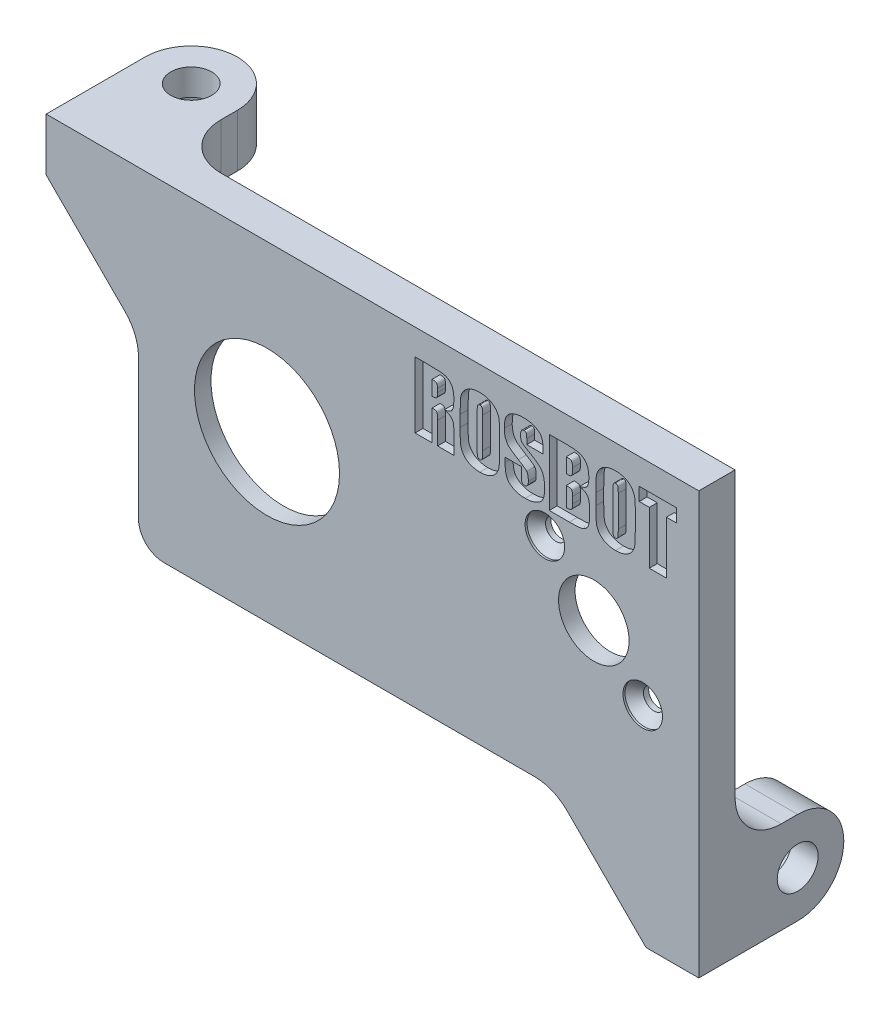
from build123d import *

# Parameters (mm, degrees)
SKETCH1_R                                      = 11
SKETCH1_R_2                                    = 5.35
SKETCH1_R_3                                    = 1.6
BOSS_EXTRUDE1_DEPTH                            = 2.5
BOSS_EXTRUDE2_DEPTH                            = 3
SKETCH3_W                                      = 8
SKETCH3_H                                      = 14
SKETCH3_W_2                                    = 14
SKETCH3_H_2                                    = 8
BOSS_EXTRUDE3_DEPTH                            = 16.5
SKETCH5_R                                      = 5
CUT_EXTRUDE2_DEPTH                             = 4
CUT_EXTRUDE3_REACH                             = 117.294
SKETCH6_R                                      = 3.1
SKETCH7_R                                      = 5
CUT_EXTRUDE4_DEPTH                             = 4
CUT_EXTRUDE5_REACH                             = 106.316
SKETCH8_R                                      = 3.1
CSK_FOR_M3_FLAT_HEAD_MACHINE_SCREW1_AT_2_COUNT = 2
CSK_FOR_M3_FLAT_HEAD_MACHINE_SCREW1_AT_2_PITCH = 21
FILLET1_R                                      = 7
SKETCH11_R                                     = 17.5
CUT_EXTRUDE6_DEPTH                             = 3
CUT_EXTRUDE7_DEPTH                             = 1.2
FILLET2_R                                      = 3.85


with BuildPart() as part:
    # Sketch1 → Boss-Extrude1 (new body)
    with BuildSketch(Plane.XY):
        Polygon((-83.075378798, 25), (-83.075378798, 17), (-69.075378798, 3), (-69.075378798, -25), (-6.075378798, -25), (7.924621202, -39), (15.924621202, -39), (15.924621202, 25), align=None)
        with Locations((-49.575378798, 0)):
            Circle(SKETCH1_R, mode=Mode.SUBTRACT)
        Circle(SKETCH1_R_2, mode=Mode.SUBTRACT)
        with Locations((-7.424621202, 7.424621202)):
            Circle(SKETCH1_R_3, mode=Mode.SUBTRACT)
        with Locations((7.424621202, -7.424621202)):
            Circle(SKETCH1_R_3, mode=Mode.SUBTRACT)
    extrude(amount=BOSS_EXTRUDE1_DEPTH)

    # Sketch2 → Boss-Extrude2 (add)
    with BuildSketch(Plane(origin=(0, 0, 0), x_dir=(-1, 0, 0), z_dir=(0, 0, -1))):
        Polygon((-15.924621202, 25), (-15.924621202, -39), (-7.924621202, -39), (6.075378798, -25), (69.075378798, -25), (69.075378798, 3), (83.075378798, 17), (83.075378798, 25), align=None)
        Polygon((4.83273811, -22), (1.83273811, -25), (-12.924621202, -25), (-12.924621202, 22), (69.075378798, 22), (69.075378798, 7.242640687), (66.075378798, 4.242640687), (66.075378798, -22), align=None, mode=Mode.SUBTRACT)
    extrude(amount=BOSS_EXTRUDE2_DEPTH)

    # Sketch3 → Boss-Extrude3 (add)
    with BuildSketch(Plane(origin=(0, 0, -3), x_dir=(-1, 0, 0), z_dir=(0, 0, -1))):
        with Locations((-11.924621202, -32)):
            Rectangle(SKETCH3_W, SKETCH3_H)
        with Locations((76.075378798, 21)):
            Rectangle(SKETCH3_W_2, SKETCH3_H_2)
    extrude(amount=BOSS_EXTRUDE3_DEPTH)

    # Sketch5 → Cut-Extrude2 (cut)
    with BuildSketch(Plane(origin=(7.924621202, -48.924621202, 0), x_dir=(0, 1, 0), z_dir=(1, 0, 0))):
        with Locations(Location((16.924621202, -12.5, 0), (0, 0, 270))):
            Circle(SKETCH5_R)
    extrude(amount=CUT_EXTRUDE2_DEPTH, mode=Mode.SUBTRACT)

    # Sketch6 → Cut-Extrude3 (cut, up to next)
    with BuildSketch(Plane(origin=(11.924621202, 23.349242405, 0), x_dir=(0, -1, 0), z_dir=(-1, 0, 0)), mode=Mode.PRIVATE) as cut_extrude3_sk1:
        with Locations(Location((55.349242405, -12.5, 0), (0, 0, 90))):
            Circle(SKETCH6_R)
    cut_extrude3_tool1 = extrude(cut_extrude3_sk1.sketch, amount=-CUT_EXTRUDE3_REACH, mode=Mode.PRIVATE) & part.part
    add(cut_extrude3_tool1.solids().sort_by_distance((11.924621, -32, -12.5))[0], mode=Mode.SUBTRACT)

    # Sketch7 → Cut-Extrude4 (cut)
    with BuildSketch(Plane(origin=(26.424621202, 17, 0), x_dir=(0, 0, 1), z_dir=(0, -1, 0))):
        with Locations(Location((-12.5, 102.5, 0), (0, 0, 180))):
            Circle(SKETCH7_R)
    extrude(amount=-CUT_EXTRUDE4_DEPTH, mode=Mode.SUBTRACT)

    # Sketch8 → Cut-Extrude5 (cut, up to next)
    with BuildSketch(Plane(origin=(0, 21, 0), x_dir=(0, 0, 1), z_dir=(0, -1, 0)), mode=Mode.PRIVATE) as cut_extrude5_sk1:
        with Locations(Location((-12.5, 76.075378798, 0), (0, 0, 270))):
            Circle(SKETCH8_R)
    cut_extrude5_tool1 = extrude(cut_extrude5_sk1.sketch, amount=-CUT_EXTRUDE5_REACH, mode=Mode.PRIVATE) & part.part
    add(cut_extrude5_tool1.solids().sort_by_distance((-76.075379, 21, -12.5))[0], mode=Mode.SUBTRACT)

    # Sketch10 → CSK for M3 Flat Head Machine Screw1 (revolve, cut)
    with BuildSketch(Plane(origin=(-7.424621202, 7.424621202, 2.5), x_dir=(0, -1, 0), z_dir=(1, 0, 0))):
        Polygon((0, 0), (0, 3.400290929), (1.5, 2.499), (1.5, 1.8), (3, 0.3), (3, 0), align=None)
    csk_for_m3_flat_head_machine_screw1 = revolve(axis=Axis((-7.424621202, 7.424621202, 8.85), (0, 0, -1)), mode=Mode.SUBTRACT)

    # CSK for M3 Flat Head Machine Screw1 at 2: CSK for M3 Flat Head Machine Screw1 ×2
    with Locations(*[Vector(0.707106781186549, -0.707106781186546, 0) * (i * CSK_FOR_M3_FLAT_HEAD_MACHINE_SCREW1_AT_2_PITCH) for i in range(1, CSK_FOR_M3_FLAT_HEAD_MACHINE_SCREW1_AT_2_COUNT)]):
        add(csk_for_m3_flat_head_machine_screw1, mode=Mode.SUBTRACT)

    # Fillet1
    # the kernel refuses this fillet: 7 mm, written as the material it adds along each edge
    with BuildSketch(Plane(origin=(-69.075378798, 3, -3), x_dir=(-0.7071067811865492, 0.7071067811865459, 0), z_dir=(0, 0, 1))) as fillet1_piece_1:
        with BuildLine():
            CenterArc((FILLET1_R * 0.414213562373, FILLET1_R), FILLET1_R, 225, 45)
            Line((-FILLET1_R * 0.292893218813, FILLET1_R * 0.292893218813), (0, 0))
            Line((0, 0), (FILLET1_R * 0.414213562373, 0))
        make_face()
    extrude(amount=5.5)
    with BuildSketch(Plane(origin=(-6.075378798, -25, -3), x_dir=(0.7071067811865499, -0.7071067811865452, 0), z_dir=(0, 0, 1))) as fillet1_piece_2:
        with BuildLine():
            CenterArc((FILLET1_R * 0.414213562373, -FILLET1_R), FILLET1_R, 90, 45)
            Line((-FILLET1_R * 0.292893218813, -FILLET1_R * 0.292893218813), (0, 0))
            Line((0, 0), (FILLET1_R * 0.414213562373, 0))
        make_face()
    extrude(amount=5.5)
    with BuildSketch(Plane(origin=(15.924621202, -25, -3), x_dir=(0, 1, 0), z_dir=(-1, 0, 0)), Plane(origin=(-69.075378798, 22, -3), x_dir=(1, 0, 0), z_dir=(0, 1, 0))) as fillet1_piece_3:
        with BuildLine():
            CenterArc((FILLET1_R, FILLET1_R), FILLET1_R, 180, 90)
            Line((0, FILLET1_R), (0, 0))
            Line((0, 0), (FILLET1_R, 0))
        make_face()
    extrude(amount=3)
    with BuildSketch(Plane(origin=(7.924621202, -25, -3), x_dir=(-1, 0, 0), z_dir=(0, -1, 0))) as fillet1_piece_4_section:
        with BuildLine():
            CenterArc((FILLET1_R, FILLET1_R), FILLET1_R, 180, 90)
            Line((0, FILLET1_R), (0, 0))
            Line((0, 0), (FILLET1_R, 0))
        make_face()
    fillet1_piece_4 = extrude(amount=31.5, mode=Mode.PRIVATE)
    fillet1_piece_4 = split(fillet1_piece_4, bisect_by=Plane(origin=(3.342862326, -34.418241124, -4.598046735), z_dir=(0.7071067811865462, 0.7071067811865488, 0)), keep=Keep.TOP, mode=Mode.PRIVATE)
    fillet1_piece_4 = fillet1_piece_4 - Plane(origin=(6.482756433, -32, -12.5), x_dir=(0, 0, -1), z_dir=(-1, 0, 0)) * Cylinder(5, 91, mode=Mode.PRIVATE)
    add(fillet1_piece_4)
    with BuildSketch(Plane(origin=(-100.575378798, 17, -3), x_dir=(0, 0, -1), z_dir=(1, 0, 0))) as fillet1_piece_5_section:
        with BuildLine():
            CenterArc((FILLET1_R, -FILLET1_R), FILLET1_R, 90, 90)
            Line((0, -FILLET1_R), (0, 0))
            Line((0, 0), (FILLET1_R, 0))
        make_face()
    fillet1_piece_5 = extrude(amount=31.5, mode=Mode.PRIVATE)
    fillet1_piece_5 = split(fillet1_piece_5, bisect_by=Plane(origin=(-78.493619852, 12.418241055, -4.598046745), z_dir=(0.7071067811865461, 0.7071067811865489, 0)), keep=Keep.TOP, mode=Mode.PRIVATE)
    fillet1_piece_5 = fillet1_piece_5 - Plane(origin=(-76.075378798, 15.558135209, -12.5), x_dir=(0, 0, -1), z_dir=(0, -1, 0)) * Cylinder(5, 91, mode=Mode.PRIVATE)
    add(fillet1_piece_5)
    # the kernel refuses this fillet: 7 mm, written as the material it takes off along each edge
    with BuildSketch(Plane(origin=(-69.075378798, -0.5, -19.5), x_dir=(0, 0, 1), z_dir=(0, 1, 0)), Plane(origin=(-9.575378798, -39, -19.5), x_dir=(0, 0, 1), z_dir=(1, 0, 0))) as fillet1_2_piece_1:
        with BuildLine():
            CenterArc((FILLET1_R, -FILLET1_R), FILLET1_R, 90, 90)
            Line((0, -FILLET1_R), (0, 0))
            Line((0, 0), (FILLET1_R, 0))
        make_face()
    extrude(amount=43, mode=Mode.SUBTRACT)
    with BuildSketch(Plane(origin=(-83.075378798, 42.5, -19.5), x_dir=(1, 0, 0), z_dir=(0, -1, 0)), Plane(origin=(33.424621202, -25, -19.5), x_dir=(0, -1, 0), z_dir=(-1, 0, 0))) as fillet1_2_piece_2:
        with BuildLine():
            CenterArc((FILLET1_R, FILLET1_R), FILLET1_R, 180, 90)
            Line((0, FILLET1_R), (0, 0))
            Line((0, 0), (FILLET1_R, 0))
        make_face()
    extrude(amount=43, mode=Mode.SUBTRACT)

    # Sketch11 → Cut-Extrude6 (cut)
    with BuildSketch(Plane(origin=(0, 0, -3), x_dir=(-1, 0, 0), z_dir=(0, 0, -1))):
        with Locations((49.575378798, 0)):
            Circle(SKETCH11_R)
    extrude(amount=-CUT_EXTRUDE6_DEPTH, mode=Mode.SUBTRACT)

    # Sketch12 → Cut-Extrude7 (cut)
    # profile 1 of 6: a face of its own
    with BuildSketch(Plane.XY.offset(2.5)):
        with BuildLine():
            Line((-27.11123462, 21.082253521), (-25.247264032, 21.082253521))
            add(Edge.make_bspline(
                [(-25.247264032, 21.082253521), (-25.097750298, 21.082111259), (-24.811569983, 21.081838959), (-24.401620237, 21.074040184), (-24.029659471, 21.063154062), (-23.69496531, 21.049424947), (-23.397738715, 21.029137103), (-23.138418633, 21.005704379), (-22.91681935, 20.979160328), (-22.727442801, 20.946215658), (-22.560530311, 20.903355334), (-22.406480095, 20.847058545), (-22.25907739, 20.780062571), (-22.120038951, 20.696352744), (-21.990341803, 20.598074853), (-21.865350225, 20.490054656), (-21.751593284, 20.364552372), (-21.642136629, 20.227474087), (-21.543193377, 20.071095988), (-21.459518473, 19.893564901), (-21.387698841, 19.695397363), (-21.329441209, 19.475713158), (-21.284320405, 19.23481106), (-21.250971544, 18.972765986), (-21.233796881, 18.689100512), (-21.230559569, 18.492812553), (-21.228881679, 18.391077051)],
                knots=[0, 0, 0, 0, 1.866779899, 3.573154429, 5.119271976, 6.513038993, 7.755301935, 8.838622109, 9.763847579, 10.541210176, 11.237085048, 11.91229758, 12.586642675, 13.255803272, 13.93365463, 14.616667368, 15.3150611, 16.045129356, 16.805014908, 17.619443337, 18.490747182, 19.433519973, 20.453845581, 21.548934602, 22.729619622, 24, 24, 24, 24], degree=3))
            add(Edge.make_bspline(
                [(-21.228881679, 18.391077051), (-21.229110661, 18.299131595), (-21.229549117, 18.123073714), (-21.245932121, 17.87058178), (-21.265376213, 17.641339421), (-21.299701229, 17.436040342), (-21.338638478, 17.253787019), (-21.387610614, 17.093764074), (-21.44750337, 16.95796896), (-21.517067507, 16.842690758), (-21.601366492, 16.745715996), (-21.701504087, 16.660465848), (-21.820770478, 16.587650798), (-21.956257213, 16.522979555), (-22.108950241, 16.468123213), (-22.279625694, 16.424887006), (-22.467397118, 16.389257017), (-22.599449732, 16.375948841), (-22.668219914, 16.369018227)],
                knots=[0, 0, 0, 0, 1.535739318, 2.940645737, 4.22619795, 5.377388088, 6.415609046, 7.338391501, 8.167869762, 8.889512328, 9.579072284, 10.305275152, 11.07790705, 11.906690103, 12.810190808, 13.783547141, 14.845718681, 16, 16, 16, 16], degree=3))
            add(Edge.make_bspline(
                [(-22.668219914, 16.369018227), (-22.606240467, 16.352193911), (-22.48665329, 16.319731982), (-22.315397299, 16.267475885), (-22.160360732, 16.209086567), (-22.022958484, 16.144219462), (-21.899634482, 16.078507095), (-21.79310567, 16.00707336), (-21.701682754, 15.931441388), (-21.604240186, 15.827803836), (-21.506338769, 15.697320561), (-21.408740848, 15.544890151), (-21.338195168, 15.39742496), (-21.296779086, 15.272304978), (-21.278528984, 15.159102399), (-21.263078818, 15.046500016), (-21.25374685, 14.903404666), (-21.244351978, 14.730619736), (-21.237504027, 14.528365165), (-21.23141574, 14.296750095), (-21.230918866, 14.03506823), (-21.229585836, 13.850634369), (-21.228881679, 13.753209403)],
                knots=[0, 0, 0, 0, 1.142598363, 2.204603636, 3.184543099, 4.08681795, 4.906404162, 5.66835307, 6.364867417, 7.012577891, 8.194392783, 9.262145755, 10.227668168, 11.096526183, 11.594793942, 12.265491166, 13.118334537, 14.144541448, 15.344519214, 16.718520618, 18.266598052, 20, 20, 20, 20], degree=3))
            Line((-21.228881679, 13.753209403), (-21.228881679, 11.082253521))
            Line((-21.228881679, 11.082253521), (-23.699469914, 11.082253521))
            Line((-23.699469914, 11.082253521), (-23.699469914, 14.464606462))
            add(Edge.make_bspline(
                [(-23.699469914, 14.464606462), (-23.699848894, 14.529557517), (-23.700567679, 14.652745848), (-23.705166937, 14.827532532), (-23.716759059, 14.983186026), (-23.730414739, 15.119465597), (-23.749028128, 15.236613968), (-23.769419615, 15.33438702), (-23.797041332, 15.412730529), (-23.828636584, 15.474973643), (-23.869800974, 15.525229323), (-23.925800514, 15.5627502), (-23.991679946, 15.598358717), (-24.072452331, 15.625579483), (-24.166379811, 15.644672046), (-24.27325056, 15.659169669), (-24.393557733, 15.66827582), (-24.478251753, 15.669723789), (-24.522999326, 15.670488815)],
                knots=[0, 0, 0, 0, 1.760695112, 3.339392938, 4.738153348, 5.990939473, 7.050443991, 7.953034352, 8.693792368, 9.295646617, 9.837944077, 10.432650982, 11.108765438, 11.865186032, 12.731754792, 13.704231872, 14.787044802, 16, 16, 16, 16], degree=3))
            Line((-24.522999326, 15.670488815), (-24.522999326, 11.082253521))
            Line((-24.522999326, 11.082253521), (-27.11123462, 11.082253521))
            Line((-27.11123462, 11.082253521), (-27.11123462, 21.082253521))
        make_face()
        with BuildLine():
            Line((-24.522999326, 19.435194698), (-24.522999326, 17.19990058))
            add(Edge.make_bspline(
                [(-24.522999326, 17.19990058), (-24.452459937, 17.20085114), (-24.321926424, 17.202610157), (-24.143664506, 17.226199134), (-23.999022009, 17.261460736), (-23.897891413, 17.305078173), (-23.837028253, 17.360807271), (-23.797898852, 17.417377685), (-23.768270543, 17.492453017), (-23.74274286, 17.58302544), (-23.723292679, 17.690149597), (-23.708348596, 17.813487322), (-23.702378234, 17.954137857), (-23.7004781, 18.053454471), (-23.699469914, 18.10615058)],
                knots=[0, 0, 0, 0, 1.706714887, 3.158284942, 4.338247242, 5.313333341, 5.775274278, 6.318418262, 6.963057242, 7.71890888, 8.594501264, 9.595306132, 10.724100569, 12, 12, 12, 12], degree=3))
            Line((-23.699469914, 18.10615058), (-23.699469914, 18.659459403))
            add(Edge.make_bspline(
                [(-23.699469914, 18.659459403), (-23.701117075, 18.732527369), (-23.704114478, 18.865492037), (-23.73579991, 19.045367046), (-23.788655081, 19.186737143), (-23.870884506, 19.293265984), (-23.989292659, 19.358381309), (-24.134882282, 19.405541494), (-24.317527311, 19.430840332), (-24.450635434, 19.433661161), (-24.522999326, 19.435194698)],
                knots=[0, 0, 0, 0, 1.304469539, 2.37379483, 3.247992823, 3.979792534, 4.721435155, 5.621572954, 6.706974207, 8, 8, 8, 8], degree=3))
        make_face(mode=Mode.SUBTRACT)
    # profile 2 of 6: a face of its own
    with BuildSketch(Plane.XY.offset(2.5)):
        with BuildLine():
            add(Edge.make_bspline(
                [(-14.287705208, 15.221959403), (-14.288379196, 15.10063608), (-14.289676114, 14.867180351), (-14.290566291, 14.530152575), (-14.295592945, 14.220665271), (-14.306112187, 13.938874512), (-14.313692835, 13.68506737), (-14.327142007, 13.45837255), (-14.341465287, 13.259167642), (-14.362237403, 13.031429794), (-14.405139786, 12.769796374), (-14.498450863, 12.472497914), (-14.63072726, 12.189664753), (-14.796755185, 11.921576923), (-14.999522503, 11.67595832), (-15.237373354, 11.459179612), (-15.508049438, 11.2723056), (-15.81115997, 11.117973131), (-16.143073778, 10.997911527), (-16.501261221, 10.908345354), (-16.88615101, 10.857981429), (-17.151533918, 10.850697089), (-17.287705208, 10.846959403)],
                knots=[0, 0, 0, 0, 1.172498254, 2.25617324, 3.257086853, 4.16358034, 4.981301874, 5.71084127, 6.358035375, 6.911319994, 7.920867218, 8.913513763, 9.91232314, 10.931067744, 11.953111379, 12.980015395, 14.031284524, 15.122408645, 16.257695467, 17.435386016, 18.684064487, 20, 20, 20, 20], degree=3))
            add(Edge.make_bspline(
                [(-17.287705208, 10.846959403), (-17.417782836, 10.849956598), (-17.672792092, 10.855832415), (-18.044382815, 10.907098516), (-18.396791393, 10.986447745), (-18.726047755, 11.102566772), (-19.030987988, 11.249589593), (-19.303612625, 11.435184576), (-19.549992512, 11.648111438), (-19.757288993, 11.897607841), (-19.931810948, 12.165949994), (-20.067247657, 12.4498517), (-20.163903292, 12.744494242), (-20.212005175, 13.002904873), (-20.23202029, 13.228545074), (-20.246686231, 13.427719559), (-20.259190751, 13.656321262), (-20.270610011, 13.913050339), (-20.27714536, 14.199267762), (-20.282713008, 14.514221766), (-20.286343646, 14.858594113), (-20.287239115, 15.097571367), (-20.287705208, 15.221959403)],
                knots=[0, 0, 0, 0, 1.256642033, 2.46357006, 3.618570477, 4.742389249, 5.8309511, 6.880538696, 7.921233455, 8.967658501, 10.004199717, 11.008151815, 11.99886371, 12.993127092, 13.540572422, 14.187830976, 14.923355754, 15.753227986, 16.671478089, 17.690255293, 18.797774242, 20, 20, 20, 20], degree=3))
            Line((-20.287705208, 15.221959403), (-20.287705208, 16.942547639))
            add(Edge.make_bspline(
                [(-20.287705208, 16.942547639), (-20.287025926, 17.063870799), (-20.285715392, 17.297938941), (-20.2848982, 17.634968983), (-20.279706063, 17.9444495), (-20.269562566, 18.225646794), (-20.260860244, 18.479973604), (-20.250872854, 18.706824928), (-20.235486675, 18.905925425), (-20.21541523, 19.133243753), (-20.169614014, 19.394507592), (-20.077039082, 19.691963461), (-19.945278639, 19.974658972), (-19.777365446, 20.241330435), (-19.57668773, 20.489297984), (-19.336298344, 20.703945976), (-19.067338595, 20.893105165), (-18.763694467, 21.045688064), (-18.432581379, 21.170124631), (-18.072888475, 21.254150357), (-17.688961502, 21.309884075), (-17.423944901, 21.314945607), (-17.287705208, 21.317547639)],
                knots=[0, 0, 0, 0, 1.172447945, 2.261997725, 3.25694795, 4.163402541, 4.981088989, 5.716199006, 6.357459993, 6.910720872, 7.921248873, 8.913852826, 9.912619346, 10.926299895, 11.952869572, 12.984107899, 14.030467631, 15.121544935, 16.258835095, 17.440814083, 18.68437411, 20, 20, 20, 20], degree=3))
            add(Edge.make_bspline(
                [(-17.287705208, 21.317547639), (-17.157644025, 21.314477851), (-16.902667009, 21.308459719), (-16.53129843, 21.25827525), (-16.180149896, 21.17544329), (-15.851592002, 21.059951064), (-15.545646758, 20.914587254), (-15.272114572, 20.730436894), (-15.027318518, 20.515657233), (-14.819717625, 20.267071873), (-14.645890827, 19.998032664), (-14.507712236, 19.715165203), (-14.411468859, 19.419378553), (-14.363173377, 19.160385284), (-14.344123473, 18.934634105), (-14.325437625, 18.736353204), (-14.317302973, 18.508091153), (-14.304303251, 18.251479169), (-14.299101442, 17.965207516), (-14.289488442, 17.650324384), (-14.28997972, 17.305897638), (-14.288483835, 17.066932123), (-14.287705208, 16.942547639)],
                knots=[0, 0, 0, 0, 1.25688243, 2.464041344, 3.614850377, 4.738884137, 5.825056982, 6.879763605, 7.916215408, 8.962840637, 9.999580144, 11.006289212, 11.99719063, 12.997466316, 13.545016373, 14.186956176, 14.922311591, 15.752342578, 16.670768344, 17.689860948, 18.797544255, 20, 20, 20, 20], degree=3))
            Line((-14.287705208, 16.942547639), (-14.287705208, 15.221959403))
        make_face()
        with BuildLine():
            add(Edge.make_bspline(
                [(-16.875940502, 18.562032933), (-16.876383644, 18.618408631), (-16.877231483, 18.726269339), (-16.881097548, 18.880073206), (-16.885681043, 19.018055124), (-16.895286687, 19.139993507), (-16.906110077, 19.246041488), (-16.917878045, 19.336543033), (-16.934466485, 19.410181373), (-16.957281216, 19.485240098), (-16.999292433, 19.559293191), (-17.07097185, 19.627547655), (-17.167780424, 19.663628866), (-17.237812542, 19.668116346), (-17.274837561, 19.670488815)],
                knots=[0, 0, 0, 0, 1.539046499, 2.944578087, 4.200164714, 5.307361679, 6.282750376, 7.110733152, 7.796572056, 8.341445889, 9.248147016, 10.088707466, 10.989525887, 12, 12, 12, 12], degree=3))
            add(Edge.make_bspline(
                [(-17.274837561, 19.670488815), (-17.307654664, 19.669306809), (-17.37070314, 19.667035931), (-17.457933858, 19.633025164), (-17.534533266, 19.582683529), (-17.586456286, 19.520794542), (-17.62093672, 19.45454225), (-17.641182873, 19.3839577), (-17.659588818, 19.294884671), (-17.672928717, 19.185986884), (-17.686843029, 19.058039143), (-17.692325642, 18.910090653), (-17.698817735, 18.742849051), (-17.699244449, 18.624542856), (-17.699469914, 18.562032933)],
                knots=[0, 0, 0, 0, 0.882400475, 1.695274696, 2.495202063, 3.342012231, 3.846135422, 4.50666316, 5.319368366, 6.306270142, 7.472339914, 8.8000339, 10.30922097, 12, 12, 12, 12], degree=3))
            Line((-17.699469914, 18.562032933), (-17.699469914, 13.799165286))
            add(Edge.make_bspline(
                [(-17.699469914, 13.799165286), (-17.698794712, 13.728699717), (-17.697508888, 13.594508228), (-17.696647741, 13.403914637), (-17.691771993, 13.234687639), (-17.681215104, 13.087154025), (-17.673866165, 12.960632447), (-17.660591287, 12.855213179), (-17.646667376, 12.770993776), (-17.626786901, 12.689041457), (-17.585480626, 12.609424908), (-17.510244976, 12.538942121), (-17.407997356, 12.499792775), (-17.333382586, 12.496038844), (-17.293219914, 12.494018227)],
                knots=[0, 0, 0, 0, 1.663340642, 3.167591802, 4.498921265, 5.658241739, 6.658825125, 7.489425773, 8.164723343, 8.673411691, 9.475700415, 10.243345305, 11.054450653, 12, 12, 12, 12], degree=3))
            add(Edge.make_bspline(
                [(-17.293219914, 12.494018227), (-17.252281284, 12.496272404), (-17.174700151, 12.500544204), (-17.070454087, 12.547885929), (-16.992957002, 12.62833041), (-16.953508857, 12.718520453), (-16.930039222, 12.809333415), (-16.917019479, 12.900670243), (-16.903957543, 13.012185171), (-16.892851311, 13.144588544), (-16.886505297, 13.297901258), (-16.880823601, 13.471926366), (-16.877297089, 13.666186718), (-16.876407307, 13.802840485), (-16.875940502, 13.874532933)],
                knots=[0, 0, 0, 0, 0.918402388, 1.740427023, 2.512163013, 3.383436019, 3.926243116, 4.625732101, 5.460198399, 6.458259481, 7.619956823, 8.919141196, 10.383693968, 12, 12, 12, 12], degree=3))
            Line((-16.875940502, 13.874532933), (-16.875940502, 18.562032933))
        make_face(mode=Mode.SUBTRACT)
    # profile 3 of 6: a face of its own
    with BuildSketch(Plane.XY.offset(2.5)):
        with BuildLine():
            Line((-7.699469914, 18.023429992), (-10.170058149, 18.023429992))
            Line((-10.170058149, 18.023429992), (-10.170058149, 18.813871168))
            add(Edge.make_bspline(
                [(-10.170058149, 18.813871168), (-10.170687305, 18.897859093), (-10.171819011, 19.048934071), (-10.189058711, 19.250791648), (-10.216789416, 19.403801634), (-10.260538283, 19.51415402), (-10.323846359, 19.588118433), (-10.401839335, 19.635876514), (-10.495624171, 19.666984195), (-10.563772705, 19.669267924), (-10.600205208, 19.670488815)],
                knots=[0, 0, 0, 0, 1.836110675, 3.302741208, 4.424827114, 5.228882099, 5.865443011, 6.515953015, 7.206622017, 8, 8, 8, 8], degree=3))
            add(Edge.make_bspline(
                [(-10.600205208, 19.670488815), (-10.639723023, 19.668101388), (-10.715740327, 19.663508882), (-10.822915852, 19.625596281), (-10.913478078, 19.560499094), (-10.988847708, 19.471163075), (-11.046133528, 19.355933998), (-11.081793316, 19.215038028), (-11.109130491, 19.050819688), (-11.110502505, 18.932274552), (-11.11123462, 18.869018227)],
                knots=[0, 0, 0, 0, 0.882142373, 1.69690771, 2.502869523, 3.348502484, 4.286047481, 5.353202765, 6.587654712, 8, 8, 8, 8], degree=3))
            add(Edge.make_bspline(
                [(-11.11123462, 18.869018227), (-11.110311216, 18.787417083), (-11.108584658, 18.63484126), (-11.08368689, 18.422361384), (-11.049570773, 18.239919582), (-11.006195325, 18.134460579), (-10.98623462, 18.085929992)],
                knots=[0, 0, 0, 0, 1.225069666, 2.290605275, 3.213363216, 4, 4, 4, 4], degree=3))
            add(Edge.make_bspline(
                [(-10.98623462, 18.085929992), (-10.97391744, 18.063516965), (-10.947473113, 18.015397392), (-10.892417868, 17.945525506), (-10.82245912, 17.871391211), (-10.733726192, 17.798123658), (-10.631389402, 17.719284294), (-10.512111971, 17.639174748), (-10.375792968, 17.557128198), (-10.27925675, 17.502371228), (-10.228881679, 17.473797639)],
                knots=[0, 0, 0, 0, 0.621359025, 1.334024637, 2.156579786, 3.097725489, 4.129453258, 5.299675385, 6.590901449, 8, 8, 8, 8], degree=3))
            add(Edge.make_bspline(
                [(-10.228881679, 17.473797639), (-10.083252106, 17.392403764), (-9.804241959, 17.236462107), (-9.410180794, 17.001317477), (-9.05902444, 16.776310728), (-8.751132044, 16.56036508), (-8.483459918, 16.358495298), (-8.260541978, 16.164018328), (-8.074098247, 15.985127797), (-7.977540438, 15.857934902), (-7.932925796, 15.799165286)],
                knots=[0, 0, 0, 0, 1.399987978, 2.682222047, 3.850399669, 4.898912503, 5.837908684, 6.661707281, 7.381640388, 8, 8, 8, 8], degree=3))
            add(Edge.make_bspline(
                [(-7.932925796, 15.799165286), (-7.894699584, 15.73994318), (-7.815394837, 15.617079996), (-7.721450464, 15.409490799), (-7.642712493, 15.177026742), (-7.577208134, 14.920106568), (-7.525978751, 14.636934046), (-7.49031899, 14.328715238), (-7.467969746, 13.994961429), (-7.465470639, 13.764276479), (-7.464175796, 13.644753521)],
                knots=[0, 0, 0, 0, 0.755791031, 1.567976878, 2.437427939, 3.388209073, 4.411251956, 5.524044322, 6.717152777, 8, 8, 8, 8], degree=3))
            add(Edge.make_bspline(
                [(-7.464175796, 13.644753521), (-7.464664762, 13.557725108), (-7.465612292, 13.389079442), (-7.479005588, 13.145060376), (-7.498906026, 12.918789199), (-7.525417841, 12.710546225), (-7.562622648, 12.520447044), (-7.606020971, 12.347730171), (-7.657111642, 12.191790714), (-7.718141219, 12.051746018), (-7.791586874, 11.923595884), (-7.879237119, 11.803528073), (-7.98032925, 11.687470956), (-8.096953122, 11.577120711), (-8.228236828, 11.47158474), (-8.375421033, 11.373442754), (-8.536893972, 11.279019817), (-8.772739286, 11.15818243), (-9.094624889, 11.032955815), (-9.50877248, 10.9236211), (-9.952980144, 10.859426448), (-10.259309126, 10.851185178), (-10.416381679, 10.846959403)],
                knots=[0, 0, 0, 0, 1.107497416, 2.146134036, 3.109178252, 3.99813931, 4.816387854, 5.572963339, 6.263472328, 6.90247397, 7.5137991, 8.139334416, 8.791524392, 9.46999425, 10.180043659, 10.932750816, 11.71920202, 12.559741855, 14.303331118, 16.1022349, 18.001390822, 20, 20, 20, 20], degree=3))
            add(Edge.make_bspline(
                [(-10.416381679, 10.846959403), (-10.504055795, 10.847610251), (-10.675977172, 10.848886506), (-10.928601826, 10.870965149), (-11.171224878, 10.900806927), (-11.404380619, 10.945648554), (-11.628187623, 11.00163386), (-11.841904951, 11.072663085), (-12.047058782, 11.15202083), (-12.238882497, 11.248432783), (-12.418846721, 11.352679), (-12.583973192, 11.463863691), (-12.732571873, 11.582715199), (-12.865508883, 11.707441132), (-12.982302175, 11.840169085), (-13.081124541, 11.980891556), (-13.167713322, 12.125937749), (-13.233930921, 12.282527513), (-13.288518001, 12.449587432), (-13.337414151, 12.630955329), (-13.373846202, 12.829226276), (-13.407993729, 13.043575208), (-13.432842289, 13.274281124), (-13.451129713, 13.52134768), (-13.462216048, 13.784357947), (-13.463509563, 13.965208345), (-13.464175796, 14.058356462)],
                knots=[0, 0, 0, 0, 1.22569019, 2.403472703, 3.543972426, 4.643126245, 5.721812748, 6.767838212, 7.791044494, 8.795125093, 9.766644267, 10.698344559, 11.576276872, 12.424947852, 13.244791156, 14.04372162, 14.827104947, 15.60238474, 16.415346987, 17.284198737, 18.22702467, 19.232968501, 20.319354312, 21.470843584, 22.697342326, 24, 24, 24, 24], degree=3))
            Line((-13.464175796, 14.058356462), (-13.464175796, 14.729312345))
            Line((-13.464175796, 14.729312345), (-10.993587561, 14.729312345))
            Line((-10.993587561, 14.729312345), (-10.993587561, 13.433356462))
            add(Edge.make_bspline(
                [(-10.993587561, 13.433356462), (-10.993362785, 13.385549169), (-10.992936119, 13.294802041), (-10.986345973, 13.165569889), (-10.980969746, 13.049396669), (-10.966534558, 12.946702322), (-10.954152536, 12.856380481), (-10.932723411, 12.780707414), (-10.91182198, 12.717222092), (-10.878010428, 12.650840202), (-10.819999411, 12.585399136), (-10.729232708, 12.53009742), (-10.616784516, 12.499619861), (-10.535441619, 12.495975662), (-10.491749326, 12.494018227)],
                knots=[0, 0, 0, 0, 1.399964175, 2.657392233, 3.790316277, 4.803157454, 5.694193129, 6.456033573, 7.103114065, 7.648944185, 8.628154654, 9.619298185, 10.721236556, 12, 12, 12, 12], degree=3))
            add(Edge.make_bspline(
                [(-10.491749326, 12.494018227), (-10.447225762, 12.495957289), (-10.362211227, 12.499659788), (-10.245071882, 12.5424129), (-10.144495454, 12.608128551), (-10.066640148, 12.704775812), (-10.005056839, 12.82533883), (-9.965522753, 12.971784772), (-9.939270079, 13.141974124), (-9.936335383, 13.263504785), (-9.934764032, 13.328577051)],
                knots=[0, 0, 0, 0, 0.935550044, 1.786365327, 2.59701399, 3.441515158, 4.372764623, 5.436873315, 6.627601813, 8, 8, 8, 8], degree=3))
            add(Edge.make_bspline(
                [(-9.934764032, 13.328577051), (-9.935388906, 13.400899937), (-9.9365865, 13.539509204), (-9.947772143, 13.737577768), (-9.964801724, 13.917051157), (-9.992958013, 14.075728509), (-10.024388857, 14.216140413), (-10.067335618, 14.334911151), (-10.113241515, 14.437756012), (-10.155553215, 14.493417482), (-10.175572855, 14.519753521)],
                knots=[0, 0, 0, 0, 1.405345699, 2.693392728, 3.854590553, 4.905871976, 5.824333091, 6.645380771, 7.359066403, 8, 8, 8, 8], degree=3))
            add(Edge.make_bspline(
                [(-10.175572855, 14.519753521), (-10.199681898, 14.545290012), (-10.253922652, 14.602742252), (-10.353950961, 14.687582635), (-10.478426448, 14.782789183), (-10.624543101, 14.891451921), (-10.796795149, 15.00887595), (-10.992742183, 15.137231459), (-11.214774113, 15.275065448), (-11.370970855, 15.370356129), (-11.453146385, 15.420488815)],
                knots=[0, 0, 0, 0, 0.537557046, 1.209400947, 2.005333879, 2.938205525, 3.997682112, 5.197642862, 6.525672313, 8, 8, 8, 8], degree=3))
            add(Edge.make_bspline(
                [(-11.453146385, 15.420488815), (-11.53535635, 15.470567814), (-11.693504542, 15.566905322), (-11.91854033, 15.707620792), (-12.122012956, 15.838736226), (-12.302472546, 15.95931521), (-12.462352767, 16.068230937), (-12.599518234, 16.167086461), (-12.716236522, 16.254897979), (-12.842783288, 16.36063152), (-12.979546873, 16.501552111), (-13.125267577, 16.692057425), (-13.255428473, 16.910842383), (-13.372539978, 17.157194536), (-13.46968481, 17.436183072), (-13.532243669, 17.752246371), (-13.576607844, 18.101832939), (-13.580033961, 18.347411017), (-13.581822855, 18.475635874)],
                knots=[0, 0, 0, 0, 1.160229675, 2.231946262, 3.19886387, 4.077597015, 4.847836815, 5.530373113, 6.115310034, 6.607974679, 7.516703557, 8.475378429, 9.492441335, 10.579318754, 11.758781032, 13.042133943, 14.455595244, 16, 16, 16, 16], degree=3))
            add(Edge.make_bspline(
                [(-13.581822855, 18.475635874), (-13.580469886, 18.569393654), (-13.577859938, 18.750257379), (-13.566252861, 19.0116506), (-13.541924711, 19.253262396), (-13.509711558, 19.475534263), (-13.467298567, 19.678699647), (-13.417321795, 19.863154809), (-13.354345646, 20.026893079), (-13.283776934, 20.173755103), (-13.201384263, 20.306554814), (-13.106872195, 20.428835026), (-13.0038406, 20.54705225), (-12.885582033, 20.653820836), (-12.757626319, 20.756225564), (-12.618619005, 20.851674662), (-12.466818003, 20.937759173), (-12.247423207, 21.045195551), (-11.946715611, 21.155636505), (-11.555362563, 21.251188908), (-11.129458625, 21.30822946), (-10.833840305, 21.314373087), (-10.681087561, 21.317547639)],
                knots=[0, 0, 0, 0, 1.193273294, 2.301887419, 3.328400059, 4.282301227, 5.158594548, 5.968352012, 6.711261984, 7.387819659, 8.039147108, 8.695727846, 9.353002766, 10.031758738, 10.719812256, 11.437875913, 12.174869463, 12.938603669, 14.544867531, 16.239404325, 18.056814251, 20, 20, 20, 20], degree=3))
            add(Edge.make_bspline(
                [(-10.681087561, 21.317547639), (-10.595907901, 21.316269923), (-10.42848554, 21.313758545), (-10.182243981, 21.300502788), (-9.94656158, 21.270756074), (-9.71948717, 21.238251586), (-9.50276875, 21.188916806), (-9.294817886, 21.133174644), (-9.097137324, 21.064739791), (-8.910352872, 20.98565291), (-8.735764108, 20.899873296), (-8.573812361, 20.811007259), (-8.431020847, 20.711413857), (-8.298477694, 20.61291796), (-8.18720437, 20.501827217), (-8.085553385, 20.390747258), (-8.003473745, 20.270747806), (-7.934415585, 20.143417289), (-7.879603219, 20.001452575), (-7.829511566, 19.842131119), (-7.790625326, 19.659692355), (-7.754942029, 19.45633477), (-7.730577348, 19.22970001), (-7.712348534, 18.98140257), (-7.70138725, 18.711027245), (-7.700125363, 18.523440037), (-7.699469914, 18.426003521)],
                knots=[0, 0, 0, 0, 1.258665126, 2.473932015, 3.640650328, 4.767380648, 5.861263212, 6.922053515, 7.947007588, 8.949117803, 9.916776883, 10.82072156, 11.674447384, 12.487508854, 13.255791159, 13.993321992, 14.70902737, 15.397593972, 16.128875377, 16.95354688, 17.862825142, 18.882327294, 20.003040562, 21.228548882, 22.560453324, 24, 24, 24, 24], degree=3))
            Line((-7.699469914, 18.426003521), (-7.699469914, 18.023429992))
        make_face()
    # profile 4 of 6: a face of its own
    with BuildSketch(Plane.XY.offset(2.5)):
        with BuildLine():
            Line((-6.758293443, 21.082253521), (-4.105719914, 21.082253521))
            add(Edge.make_bspline(
                [(-4.105719914, 21.082253521), (-4.004001629, 21.081251053), (-3.8072807, 21.079312301), (-3.521623148, 21.072862243), (-3.254888703, 21.058657356), (-3.007450661, 21.035594917), (-2.778442234, 21.011434817), (-2.568823394, 20.977907796), (-2.377946071, 20.939927046), (-2.203781943, 20.895996263), (-2.043441737, 20.841822264), (-1.892085707, 20.77816928), (-1.749507446, 20.70012764), (-1.615373442, 20.609541262), (-1.487523312, 20.508156058), (-1.36832457, 20.394186191), (-1.257297593, 20.267915987), (-1.153322518, 20.129253389), (-1.057862518, 19.973515006), (-0.977456053, 19.795475179), (-0.910460373, 19.595605345), (-0.852732128, 19.374775165), (-0.812421808, 19.131564719), (-0.781315696, 18.867199321), (-0.760165141, 18.580753974), (-0.758932089, 18.381925667), (-0.758293443, 18.278944698)],
                knots=[0, 0, 0, 0, 1.41969272, 2.745654521, 3.987543411, 5.14658096, 6.21373459, 7.200711201, 8.108042895, 8.929411192, 9.70554979, 10.467999137, 11.218070552, 11.969943563, 12.724535131, 13.49271798, 14.268243868, 15.068689038, 15.909069341, 16.81215954, 17.78844528, 18.848344307, 19.994182421, 21.225693104, 22.563077773, 24, 24, 24, 24], degree=3))
            add(Edge.make_bspline(
                [(-0.758293443, 18.278944698), (-0.758585046, 18.209670095), (-0.759145776, 18.076459997), (-0.774877656, 17.885106429), (-0.796561152, 17.710254321), (-0.824671486, 17.550581818), (-0.865171509, 17.408135129), (-0.912865959, 17.280957714), (-0.969333872, 17.169909476), (-1.037156168, 17.073074708), (-1.118961143, 16.988344355), (-1.216379263, 16.91075472), (-1.329504299, 16.837668458), (-1.46115394, 16.772088721), (-1.607309072, 16.706437558), (-1.773247462, 16.652023325), (-1.954124427, 16.596973784), (-2.081604237, 16.567955368), (-2.147999326, 16.552841756)],
                knots=[0, 0, 0, 0, 1.327920484, 2.553495959, 3.678584238, 4.706394844, 5.65862556, 6.514014339, 7.30753027, 8.04101456, 8.772331145, 9.55771541, 10.424646689, 11.349518022, 12.375513716, 13.493956262, 14.694781581, 16, 16, 16, 16], degree=3))
            add(Edge.make_bspline(
                [(-2.147999326, 16.552841756), (-2.077259087, 16.535447263), (-1.94064086, 16.501853868), (-1.746584522, 16.436977289), (-1.570324082, 16.363763704), (-1.410830997, 16.283456535), (-1.269832748, 16.192735022), (-1.146454772, 16.093678004), (-1.039694483, 15.986637494), (-0.95228898, 15.868049962), (-0.877576596, 15.738386513), (-0.813006468, 15.594443257), (-0.760862324, 15.433853639), (-0.716438704, 15.257644254), (-0.682022481, 15.066025842), (-0.658713256, 14.85784291), (-0.643969056, 14.634548722), (-0.641776458, 14.479949326), (-0.640646385, 14.400268227)],
                knots=[0, 0, 0, 0, 1.193541528, 2.305046348, 3.349469872, 4.319601517, 5.227715379, 6.091898615, 6.908561027, 7.697906746, 8.498857849, 9.357421084, 10.27838222, 11.262396817, 12.333987418, 13.466302598, 14.694123014, 16, 16, 16, 16], degree=3))
            Line((-0.640646385, 14.400268227), (-0.640646385, 13.460929992))
            add(Edge.make_bspline(
                [(-0.640646385, 13.460929992), (-0.64130227, 13.378196286), (-0.642570942, 13.218165436), (-0.653678292, 12.986391962), (-0.671671579, 12.771115401), (-0.697098625, 12.572322174), (-0.729819968, 12.389982633), (-0.769921752, 12.224101348), (-0.817276628, 12.074544396), (-0.889389264, 11.900654987), (-1.000395385, 11.708795616), (-1.173897677, 11.51691214), (-1.381418876, 11.36337163), (-1.585457013, 11.269880041), (-1.776395793, 11.215785677), (-1.955218274, 11.179478928), (-2.166942061, 11.148920123), (-2.413080774, 11.126487368), (-2.69127435, 11.106110197), (-3.003858972, 11.091220925), (-3.349570034, 11.0852411), (-3.591626107, 11.083277493), (-3.717852267, 11.082253521)],
                knots=[0, 0, 0, 0, 1.057231904, 2.044991421, 2.964498811, 3.817267374, 4.605195048, 5.330688826, 5.996832831, 6.607610909, 7.734358025, 8.809960447, 9.890596186, 11.011751471, 11.656044114, 12.423911222, 13.341950389, 14.388368498, 15.581715371, 16.906549738, 18.386843414, 20, 20, 20, 20], degree=3))
            Line((-3.717852267, 11.082253521), (-6.758293443, 11.082253521))
            Line((-6.758293443, 11.082253521), (-6.758293443, 21.082253521))
        make_face()
        with BuildLine():
            Line((-4.170058149, 19.435194698), (-4.170058149, 17.19990058))
            add(Edge.make_bspline(
                [(-4.170058149, 17.19990058), (-4.11552603, 17.20124344), (-4.019947432, 17.203597076), (-3.924348608, 17.204869038), (-3.883293443, 17.205415286)],
                knots=[0, 0, 0, 0, 1.141094767, 2, 2, 2, 2], degree=3))
            add(Edge.make_bspline(
                [(-3.883293443, 17.205415286), (-3.818691325, 17.206575575), (-3.701646689, 17.20867776), (-3.544760262, 17.245526524), (-3.422374686, 17.30234028), (-3.348734678, 17.378546153), (-3.313284026, 17.459127977), (-3.290081393, 17.540061482), (-3.273138036, 17.643198001), (-3.256339925, 17.767557612), (-3.244143079, 17.914811406), (-3.235242139, 18.083384946), (-3.229767141, 18.274007555), (-3.22918825, 18.408230187), (-3.228881679, 18.479312345)],
                knots=[0, 0, 0, 0, 1.37184632, 2.485479705, 3.407178563, 4.210095408, 4.671083265, 5.269542147, 5.998719677, 6.893441603, 7.940942625, 9.142754617, 10.486848569, 12, 12, 12, 12], degree=3))
            add(Edge.make_bspline(
                [(-3.228881679, 18.479312345), (-3.229526678, 18.552290602), (-3.230716224, 18.68688142), (-3.249048176, 18.870626939), (-3.275599228, 19.020254985), (-3.318698808, 19.13671262), (-3.37161611, 19.226216029), (-3.431360598, 19.295975358), (-3.498121567, 19.349544251), (-3.578627573, 19.384566291), (-3.679597887, 19.405737564), (-3.810589138, 19.421103002), (-3.978122393, 19.431515561), (-4.102027186, 19.43389064), (-4.170058149, 19.435194698)],
                knots=[0, 0, 0, 0, 1.612962093, 2.974720053, 4.080187332, 4.963539136, 5.704836737, 6.3676796, 6.985654596, 7.580003915, 8.289925548, 9.259673838, 10.495400982, 12, 12, 12, 12], degree=3))
        make_face(mode=Mode.SUBTRACT)
        with BuildLine():
            Line((-4.170058149, 15.670488815), (-4.170058149, 12.729312345))
            add(Edge.make_bspline(
                [(-4.170058149, 12.729312345), (-4.121638668, 12.731476965), (-4.029603708, 12.735591441), (-3.898203129, 12.745912539), (-3.781135747, 12.762737371), (-3.677016671, 12.782029922), (-3.586808441, 12.807986391), (-3.509555264, 12.836679646), (-3.445384795, 12.86907956), (-3.394416552, 12.909615089), (-3.354261256, 12.960986375), (-3.318949828, 13.023766484), (-3.292661423, 13.103287975), (-3.268985582, 13.195962729), (-3.2508211, 13.303575728), (-3.238977177, 13.425810651), (-3.228738733, 13.562480769), (-3.228832667, 13.658823919), (-3.228881679, 13.709091756)],
                knots=[0, 0, 0, 0, 1.419095288, 2.697393149, 3.856866357, 4.880718774, 5.794967692, 6.601281627, 7.291456808, 7.891047755, 8.490638702, 9.189387817, 9.989490768, 10.933700266, 11.989587216, 13.180284702, 14.528790147, 16, 16, 16, 16], degree=3))
            Line((-3.228881679, 13.709091756), (-3.228881679, 14.690709403))
            add(Edge.make_bspline(
                [(-3.228881679, 14.690709403), (-3.229104744, 14.744019305), (-3.22952805, 14.845183935), (-3.236107425, 14.988826505), (-3.250660304, 15.116008516), (-3.262039658, 15.227356569), (-3.285814751, 15.320858214), (-3.30979079, 15.398843904), (-3.34098184, 15.460256784), (-3.377303804, 15.508759032), (-3.426815003, 15.543504213), (-3.487110831, 15.574546172), (-3.564273043, 15.599455648), (-3.655921958, 15.620973396), (-3.762794542, 15.639001092), (-3.884871589, 15.653488105), (-4.022241473, 15.664325308), (-4.119182502, 15.668367455), (-4.170058149, 15.670488815)],
                knots=[0, 0, 0, 0, 1.538310229, 2.919206019, 4.145426389, 5.233175983, 6.142307499, 6.925059207, 7.5813867, 8.122596664, 8.653013429, 9.309340922, 10.075339784, 10.9844713, 12.025073956, 13.200531974, 14.530810454, 16, 16, 16, 16], degree=3))
        make_face(mode=Mode.SUBTRACT)
    # profile 5 of 6: a face of its own
    with BuildSketch(Plane.XY.offset(2.5)):
        with BuildLine():
            add(Edge.make_bspline(
                [(6.300530086, 15.221959403), (6.299856098, 15.10063608), (6.29855918, 14.867180351), (6.297669004, 14.530152575), (6.292642349, 14.220665271), (6.282123107, 13.938874512), (6.274542459, 13.68506737), (6.261093287, 13.45837255), (6.246770007, 13.259167642), (6.225997891, 13.031429794), (6.183095508, 12.769796374), (6.089784431, 12.472497914), (5.957508034, 12.189664753), (5.791480109, 11.921576923), (5.588712791, 11.67595832), (5.35086194, 11.459179612), (5.080185856, 11.2723056), (4.777075325, 11.117973131), (4.445161516, 10.997911527), (4.086974074, 10.908345354), (3.702084284, 10.857981429), (3.436701376, 10.850697089), (3.300530086, 10.846959403)],
                knots=[0, 0, 0, 0, 1.172498254, 2.25617324, 3.257086853, 4.16358034, 4.981301874, 5.71084127, 6.358035375, 6.911319994, 7.920867218, 8.913513763, 9.91232314, 10.931067744, 11.953111379, 12.980015395, 14.031284524, 15.122408645, 16.257695467, 17.435386016, 18.684064487, 20, 20, 20, 20], degree=3))
            add(Edge.make_bspline(
                [(3.300530086, 10.846959403), (3.170452458, 10.849956598), (2.915443202, 10.855832415), (2.543852479, 10.907098516), (2.191443901, 10.986447745), (1.862187539, 11.102566772), (1.557247306, 11.249589593), (1.284622669, 11.435184576), (1.038242782, 11.648111438), (0.830946301, 11.897607841), (0.656424346, 12.165949994), (0.520987638, 12.4498517), (0.424332003, 12.744494242), (0.376230119, 13.002904873), (0.356215004, 13.228545074), (0.341549063, 13.427719559), (0.329044544, 13.656321262), (0.317625283, 13.913050339), (0.311089934, 14.199267762), (0.305522287, 14.514221766), (0.301891648, 14.858594113), (0.300996179, 15.097571367), (0.300530086, 15.221959403)],
                knots=[0, 0, 0, 0, 1.256642033, 2.46357006, 3.618570477, 4.742389249, 5.8309511, 6.880538696, 7.921233455, 8.967658501, 10.004199717, 11.008151815, 11.99886371, 12.993127092, 13.540572422, 14.187830976, 14.923355754, 15.753227986, 16.671478089, 17.690255293, 18.797774242, 20, 20, 20, 20], degree=3))
            Line((0.300530086, 15.221959403), (0.300530086, 16.942547639))
            add(Edge.make_bspline(
                [(0.300530086, 16.942547639), (0.301209368, 17.063870799), (0.302519902, 17.297938941), (0.303337094, 17.634968983), (0.308529231, 17.9444495), (0.318672728, 18.225646794), (0.32737505, 18.479973604), (0.33736244, 18.706824928), (0.352748619, 18.905925425), (0.372820064, 19.133243753), (0.41862128, 19.394507592), (0.511196212, 19.691963461), (0.642956655, 19.974658972), (0.810869848, 20.241330435), (1.011547564, 20.489297984), (1.25193695, 20.703945976), (1.520896699, 20.893105165), (1.824540827, 21.045688064), (2.155653915, 21.170124631), (2.515346819, 21.254150357), (2.899273792, 21.309884075), (3.164290394, 21.314945607), (3.300530086, 21.317547639)],
                knots=[0, 0, 0, 0, 1.172447945, 2.261997725, 3.25694795, 4.163402541, 4.981088989, 5.716199006, 6.357459993, 6.910720872, 7.921248873, 8.913852826, 9.912619346, 10.926299895, 11.952869572, 12.984107899, 14.030467631, 15.121544935, 16.258835095, 17.440814083, 18.68437411, 20, 20, 20, 20], degree=3))
            add(Edge.make_bspline(
                [(3.300530086, 21.317547639), (3.430591269, 21.314477851), (3.685568285, 21.308459719), (4.056936864, 21.25827525), (4.408085398, 21.17544329), (4.736643292, 21.059951064), (5.042588537, 20.914587254), (5.316120722, 20.730436894), (5.560916776, 20.515657233), (5.768517669, 20.267071873), (5.942344467, 19.998032664), (6.080523058, 19.715165203), (6.176766435, 19.419378553), (6.225061917, 19.160385284), (6.244111821, 18.934634105), (6.262797669, 18.736353204), (6.270932321, 18.508091153), (6.283932043, 18.251479169), (6.289133852, 17.965207516), (6.298746853, 17.650324384), (6.298255574, 17.305897638), (6.299751459, 17.066932123), (6.300530086, 16.942547639)],
                knots=[0, 0, 0, 0, 1.25688243, 2.464041344, 3.614850377, 4.738884137, 5.825056982, 6.879763605, 7.916215408, 8.962840637, 9.999580144, 11.006289212, 11.99719063, 12.997466316, 13.545016373, 14.186956176, 14.922311591, 15.752342578, 16.670768344, 17.689860948, 18.797544255, 20, 20, 20, 20], degree=3))
            Line((6.300530086, 16.942547639), (6.300530086, 15.221959403))
        make_face()
        with BuildLine():
            add(Edge.make_bspline(
                [(3.712294792, 18.562032933), (3.711851651, 18.618408631), (3.711003811, 18.726269339), (3.707137747, 18.880073206), (3.702554251, 19.018055124), (3.692948607, 19.139993507), (3.682125217, 19.246041488), (3.670357249, 19.336543033), (3.653768809, 19.410181373), (3.630954078, 19.485240098), (3.588942862, 19.559293191), (3.517263444, 19.627547655), (3.420454871, 19.663628866), (3.350422752, 19.668116346), (3.313397733, 19.670488815)],
                knots=[0, 0, 0, 0, 1.539046499, 2.944578087, 4.200164714, 5.307361679, 6.282750376, 7.110733152, 7.796572056, 8.341445889, 9.248147016, 10.088707466, 10.989525887, 12, 12, 12, 12], degree=3))
            add(Edge.make_bspline(
                [(3.313397733, 19.670488815), (3.28058063, 19.669306809), (3.217532154, 19.667035931), (3.130301436, 19.633025164), (3.053702028, 19.582683529), (3.001779008, 19.520794542), (2.967298574, 19.45454225), (2.947052421, 19.3839577), (2.928646476, 19.294884671), (2.915306578, 19.185986884), (2.901392266, 19.058039143), (2.895909652, 18.910090653), (2.889417559, 18.742849051), (2.888990845, 18.624542856), (2.88876538, 18.562032933)],
                knots=[0, 0, 0, 0, 0.882400475, 1.695274696, 2.495202063, 3.342012231, 3.846135422, 4.50666316, 5.319368366, 6.306270142, 7.472339914, 8.8000339, 10.30922097, 12, 12, 12, 12], degree=3))
            Line((2.88876538, 18.562032933), (2.88876538, 13.799165286))
            add(Edge.make_bspline(
                [(2.88876538, 13.799165286), (2.889440582, 13.728699717), (2.890726406, 13.594508228), (2.891587553, 13.403914637), (2.896463301, 13.234687639), (2.90702019, 13.087154025), (2.914369129, 12.960632447), (2.927644007, 12.855213179), (2.941567918, 12.770993776), (2.961448393, 12.689041457), (3.002754668, 12.609424908), (3.077990318, 12.538942121), (3.180237938, 12.499792775), (3.254852708, 12.496038844), (3.29501538, 12.494018227)],
                knots=[0, 0, 0, 0, 1.663340642, 3.167591802, 4.498921265, 5.658241739, 6.658825125, 7.489425773, 8.164723343, 8.673411691, 9.475700415, 10.243345305, 11.054450653, 12, 12, 12, 12], degree=3))
            add(Edge.make_bspline(
                [(3.29501538, 12.494018227), (3.33595401, 12.496272404), (3.413535143, 12.500544204), (3.517781208, 12.547885929), (3.595278292, 12.62833041), (3.634726437, 12.718520453), (3.658196072, 12.809333415), (3.671215815, 12.900670243), (3.684277751, 13.012185171), (3.695383983, 13.144588544), (3.701729997, 13.297901258), (3.707411693, 13.471926366), (3.710938205, 13.666186718), (3.711827987, 13.802840485), (3.712294792, 13.874532933)],
                knots=[0, 0, 0, 0, 0.918402388, 1.740427023, 2.512163013, 3.383436019, 3.926243116, 4.625732101, 5.460198399, 6.458259481, 7.619956823, 8.919141196, 10.383693968, 12, 12, 12, 12], degree=3))
            Line((3.712294792, 13.874532933), (3.712294792, 18.562032933))
        make_face(mode=Mode.SUBTRACT)
    # profile 6 of 6: a face of its own
    with BuildSketch(Plane.XY.offset(2.5)):
        Polygon((12.535824204, 21.082253521), (12.535824204, 19.082253521), (11.006412439, 19.082253521), (11.006412439, 11.082253521), (8.418177145, 11.082253521), (8.418177145, 19.082253521), (6.88876538, 19.082253521), (6.88876538, 21.082253521), align=None)
    extrude(amount=-CUT_EXTRUDE7_DEPTH, mode=Mode.SUBTRACT)

    # Fillet2
    fillet2_edges = [part.edges().sort_by_distance(p)[0] for p in [
        (-69.075378798, -25, -0.25),
        (-66.075378798, -5.830951895, -1.5),
        (-66.454141508, 4.621403398, -1.5),
        (-69.075378798, 22, -5),
        (-69.075378798, 7.242640687, -1.5),
        (-66.075378798, -22, -1.5),
        (-4.83273811, -22, -1.5),
        (-1.83273811, -25, -1.5),
        (12.924621202, -25, -5),
        (12.924621202, 22, -1.5),
    ]]
    fillet(fillet2_edges, radius=FILLET2_R)


solid = part.part
